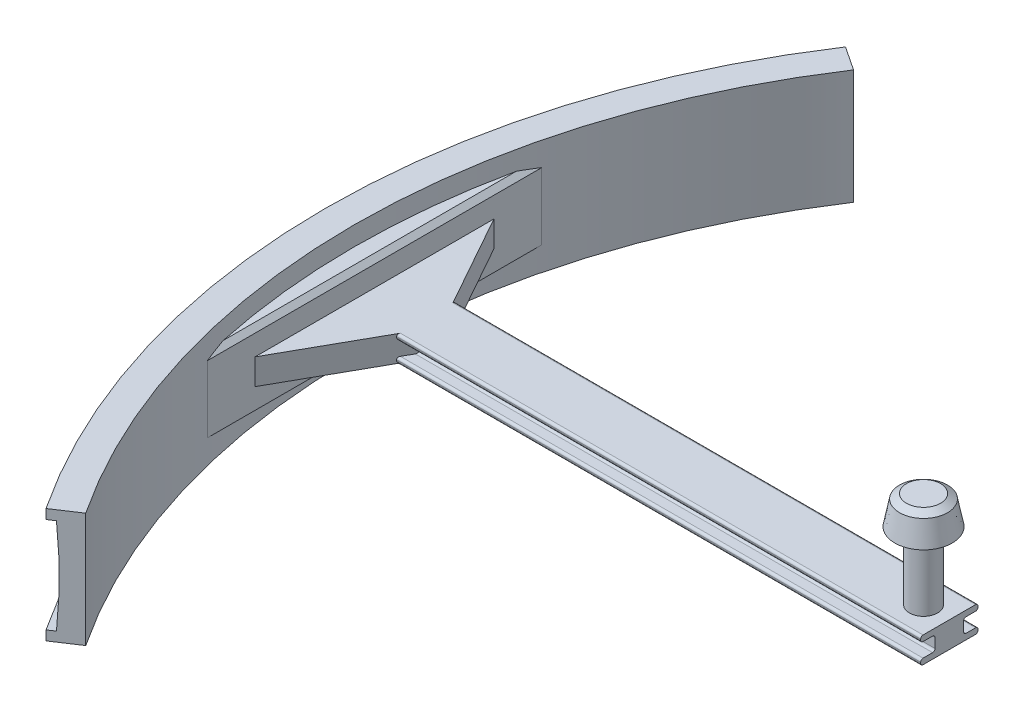
from build123d import *

# Parameters (mm, degrees)
REVOLVE1_ANGLE                  = 67
BOSS_EXTRUDE1_REACH             = 76.037
BOSS_EXTRUDE1_END_RADIUS        = 72.791303716
BOSS_EXTRUDE1_DIRECTION_2_DEPTH = 4.5
BOSS_EXTRUDE2_DEPTH             = 4
BOSS_EXTRUDE3_DEPTH             = 1.35
CHAMFER1_SIZE                   = 0.5
SKETCH5_R                       = 1.475
BOSS_EXTRUDE4_DEPTH             = 7.1
SKETCH6_R                       = 3
BOSS_EXTRUDE5_DEPTH             = 3
BOSS_EXTRUDE5_TAPER             = 11
CHAMFER2_SIZE                   = 0.5
CHAMFER2_SIZE_2                 = 0.632256576


with BuildPart() as part:
    # Sketch1 → Revolve1 (revolve, symmetric)
    with BuildSketch(Plane.XY) as revolve1_sk:
        with BuildLine():
            Line((-60, 5), (-60.791303716, 5))
            Line((-60.791303716, 5), (-60.791303716, 6))
            Line((-60.791303716, 6), (-57.791303716, 6))
            Line((-57.791303716, 6), (-57.791303716, -6))
            Line((-57.791303716, -6), (-60.791303716, -6))
            Line((-60.791303716, -6), (-60.791303716, -5))
            Line((-60.791303716, -5), (-60, -5))
            ThreePointArc((-60, -5), (-59.791303716, 0), (-60, 5))
        make_face()
    revolve(axis=Axis((15, 24.442446043, 0), (0, -1, 0)), revolution_arc=REVOLVE1_ANGLE / 2)
    revolve(revolve1_sk.sketch, axis=Axis((15, 24.442446043, 0), (0, 1, 0)), revolution_arc=REVOLVE1_ANGLE / 2)

    # Boss-Extrude1: up to this cylinder (the profile starts inside it)
    boss_extrude1_end = Plane(origin=(15, 0, 0), z_dir=(0, 1, 0)) * Cylinder(BOSS_EXTRUDE1_END_RADIUS, 298.656607431, mode=Mode.PRIVATE)
    # Sketch2 → Boss-Extrude1 (add, up to the surface)
    with BuildSketch(Plane(origin=(0, 0, 0), x_dir=(0, 0, -1), z_dir=(1, 0, 0)), mode=Mode.PRIVATE) as boss_extrude1_sk1:
        with BuildLine():
            Line((2.75, 1.35), (-2.75, 1.35))
            ThreePointArc((-2.75, 1.35), (-2.926776695, 1.276776695), (-3, 1.1))
            Line((-3, 1.1), (-3, 1))
            ThreePointArc((-3, 1), (-2.926776695, 0.823223305), (-2.75, 0.75))
            Line((-2.75, 0.75), (-1.75, 0.75))
            ThreePointArc((-1.75, 0.75), (-1.573223305, 0.676776695), (-1.5, 0.5))
            Line((-1.5, 0.5), (-1.5, -0.5))
            ThreePointArc((-1.5, -0.5), (-1.573223305, -0.676776695), (-1.75, -0.75))
            Line((-1.75, -0.75), (-2.75, -0.75))
            ThreePointArc((-2.75, -0.75), (-2.926776695, -0.823223305), (-3, -1))
            Line((-3, -1), (-3, -1.1))
            ThreePointArc((-3, -1.1), (-2.926776695, -1.276776695), (-2.75, -1.35))
            Line((-2.75, -1.35), (2.75, -1.35))
            ThreePointArc((2.75, -1.35), (2.926776695, -1.276776695), (3, -1.1))
            Line((3, -1.1), (3, -1))
            ThreePointArc((3, -1), (2.926776695, -0.823223305), (2.75, -0.75))
            Line((2.75, -0.75), (1.75, -0.75))
            ThreePointArc((1.75, -0.75), (1.573223305, -0.676776695), (1.5, -0.5))
            Line((1.5, -0.5), (1.5, 0.5))
            ThreePointArc((1.5, 0.5), (1.573223305, 0.676776695), (1.75, 0.75))
            Line((1.75, 0.75), (2.75, 0.75))
            ThreePointArc((2.75, 0.75), (2.926776695, 0.823223305), (3, 1))
            Line((3, 1), (3, 1.1))
            ThreePointArc((3, 1.1), (2.926776695, 1.276776695), (2.75, 1.35))
        make_face()
    boss_extrude1_tool1 = extrude(boss_extrude1_sk1.sketch, amount=-BOSS_EXTRUDE1_REACH, mode=Mode.PRIVATE) & boss_extrude1_end
    add(boss_extrude1_tool1.solids().sort_by_distance((0, 0, 0))[0])

    # Sketch2 → Boss-Extrude1 direction 2 (add)
    with BuildSketch(Plane(origin=(0, 0, 0), x_dir=(0, 0, -1), z_dir=(1, 0, 0))):
        with BuildLine():
            Line((2.75, 1.35), (-2.75, 1.35))
            ThreePointArc((-2.75, 1.35), (-2.926776695, 1.276776695), (-3, 1.1))
            Line((-3, 1.1), (-3, 1))
            ThreePointArc((-3, 1), (-2.926776695, 0.823223305), (-2.75, 0.75))
            Line((-2.75, 0.75), (-1.75, 0.75))
            ThreePointArc((-1.75, 0.75), (-1.573223305, 0.676776695), (-1.5, 0.5))
            Line((-1.5, 0.5), (-1.5, -0.5))
            ThreePointArc((-1.5, -0.5), (-1.573223305, -0.676776695), (-1.75, -0.75))
            Line((-1.75, -0.75), (-2.75, -0.75))
            ThreePointArc((-2.75, -0.75), (-2.926776695, -0.823223305), (-3, -1))
            Line((-3, -1), (-3, -1.1))
            ThreePointArc((-3, -1.1), (-2.926776695, -1.276776695), (-2.75, -1.35))
            Line((-2.75, -1.35), (2.75, -1.35))
            ThreePointArc((2.75, -1.35), (2.926776695, -1.276776695), (3, -1.1))
            Line((3, -1.1), (3, -1))
            ThreePointArc((3, -1), (2.926776695, -0.823223305), (2.75, -0.75))
            Line((2.75, -0.75), (1.75, -0.75))
            ThreePointArc((1.75, -0.75), (1.573223305, -0.676776695), (1.5, -0.5))
            Line((1.5, -0.5), (1.5, 0.5))
            ThreePointArc((1.5, 0.5), (1.573223305, 0.676776695), (1.75, 0.75))
            Line((1.75, 0.75), (2.75, 0.75))
            ThreePointArc((2.75, 0.75), (2.926776695, 0.823223305), (3, 1))
            Line((3, 1), (3, 1.1))
            ThreePointArc((3, 1.1), (2.926776695, 1.276776695), (2.75, 1.35))
        make_face()
    extrude(amount=BOSS_EXTRUDE1_DIRECTION_2_DEPTH)

    # Sketch3 → Boss-Extrude2 (add, symmetric)
    with BuildSketch(Plane(origin=(0, 0, 0), x_dir=(1, 0, 0), z_dir=(0, 1, 0))):
        with BuildLine():
            Line((-55.656379023, 17.5), (-55.656379023, -17.5))
            ThreePointArc((-55.656379023, -17.5), (-57.791303716, 0), (-55.656379023, 17.5))
        make_face()
    extrude(amount=BOSS_EXTRUDE2_DEPTH, both=True)

    # Sketch4 → Boss-Extrude3 (add, symmetric)
    with BuildSketch(Plane(origin=(0, 0, 0), x_dir=(1, 0, 0), z_dir=(0, 1, 0))):
        Polygon((-55.656379023, -12.5), (-55.656379023, 12.5), (-48.656379023, 0), align=None)
    extrude(amount=BOSS_EXTRUDE3_DEPTH, both=True)

    # Chamfer1
    chamfer1_edges = [part.edges().sort_by_distance(p)[0] for p in [
        (-55.656379023, -4, 0),
        (-55.656379023, 4, 0),
    ]]
    chamfer(chamfer1_edges, length=CHAMFER1_SIZE)

    # Sketch5 → Boss-Extrude4 (add)
    with BuildSketch(Plane(origin=(0, 1.35, 0), x_dir=(1, 0, 0), z_dir=(0, 1, 0))):
        with Locations(Location((1.8, 0, 0), (0, 0, 90))):
            Circle(SKETCH5_R)
    extrude(amount=BOSS_EXTRUDE4_DEPTH)

    # Sketch6 → Boss-Extrude5 (add)
    with BuildSketch(Plane(origin=(0, 8.45, 0), x_dir=(1, 0, 0), z_dir=(0, 1, 0))):
        with Locations((1.8, 0)):
            Circle(SKETCH6_R)
    extrude(amount=BOSS_EXTRUDE5_DEPTH, taper=BOSS_EXTRUDE5_TAPER)

    # Chamfer2
    # the kernel refuses this chamfer: 0.632256576, 0.5 mm, written as the material it takes off along each edge
    with BuildSketch(Plane(origin=(1.8, 11.45, 0), x_dir=(1, 0, 0), z_dir=(0, 0, -1))) as chamfer2_piece_1:
        Polygon((2.416859073 + CHAMFER2_SIZE * 0.190808995377, CHAMFER2_SIZE * 0.981627183448), (2.416859073 - CHAMFER2_SIZE_2, 0), (2.416859073, 0), align=None)
    revolve(axis=Axis((1.8, 11.45, 0), (0, -1, 0)), mode=Mode.SUBTRACT)


solid = part.part
